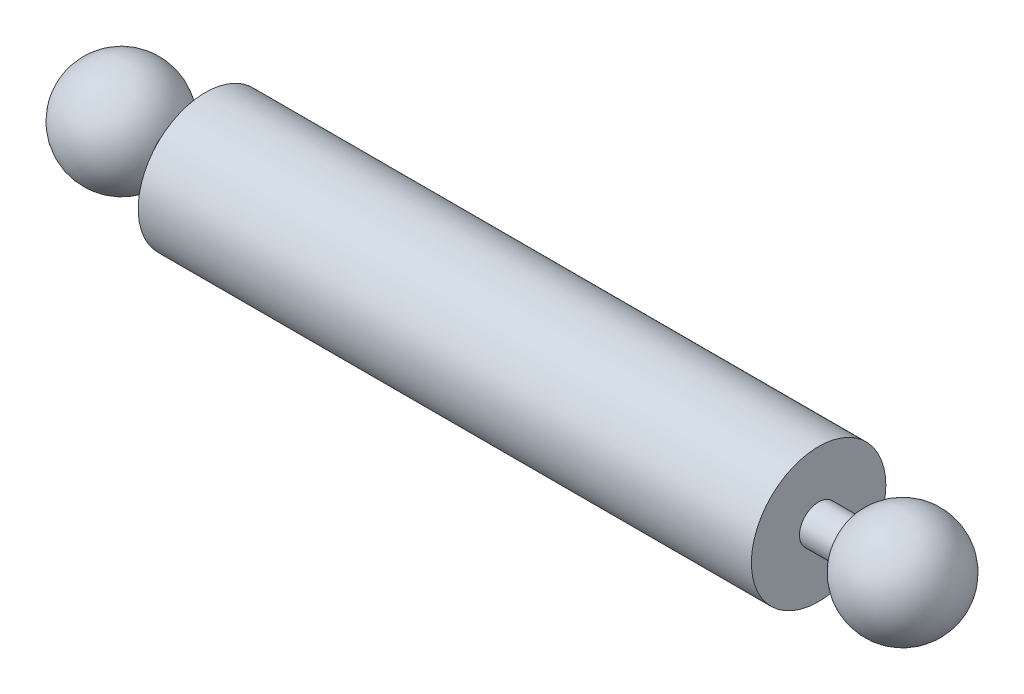
from build123d import *

# Parameters (mm, degrees)
SKETCH1_R           = 5.56895
BOSS_EXTRUDE1_DEPTH = 25.4
SKETCH2_R           = 1.5875
BOSS_EXTRUDE2_DEPTH = 3.175
SKETCH5_R           = 1.5875
CUT_EXTRUDE1_DEPTH  = 6.35
THREAD1_PITCH       = 0.529166667


with BuildPart() as part:
    # Sketch1 → Boss-Extrude1 (new, symmetric)
    with BuildSketch(Plane(origin=(0, 0, 0), x_dir=(0, 0, -1), z_dir=(1, 0, 0))):
        Circle(SKETCH1_R)
    extrude(amount=BOSS_EXTRUDE1_DEPTH, both=True)

    # Sketch2 → Boss-Extrude2 (add)
    with BuildSketch(Plane.ZY.offset(25.4)):
        Circle(SKETCH2_R)
    boss_extrude2 = extrude(amount=BOSS_EXTRUDE2_DEPTH)

    # Sketch4 → Revolve1 (revolve)
    with BuildSketch(Plane.XY):
        with BuildLine():
            Line((-36.7792, 0), (-27.94, 0))
            ThreePointArc((-27.94, 0), (-32.3596, 4.4196), (-36.7792, 0))
        make_face()
    revolve1 = revolve(axis=Axis((-36.7792, 0, 0), (1, 0, 0)))

    # Mirror1: Boss-Extrude2, Revolve1 across plane
    add(boss_extrude2.mirror(Plane(origin=(0, 0, 0), x_dir=(0, 0, 1), z_dir=(1, 0, 0))))
    add(revolve1.mirror(Plane(origin=(0, 0, 0), x_dir=(0, 0, 1), z_dir=(1, 0, 0))))

    # Sketch5 → Cut-Extrude1 (cut)
    with BuildSketch(Plane.XY):
        with Locations((12.7, 0)):
            Circle(SKETCH5_R)
    extrude(amount=-CUT_EXTRUDE1_DEPTH, mode=Mode.SUBTRACT)

    # Thread1: the profile of Thread Profile2 profile screwed along a right-hand helix of 11.099213 turns, 6 arcs to a turn; built about Z, then put on its axis
    thread1_z = Axis((0, 0, 0), (0, 0, 1))
    thread1_corners = [(1.5872, 0, -0.000173205), (1.873919859, 0, 0.165364583), (1.873919859, 0, 0.231510416), (1.5872, 0, 0.397048204)]
    with BuildLine(mode=Mode.PRIVATE) as thread1_profile:
        Line(thread1_corners[0], thread1_corners[1])
        Line(thread1_corners[1], thread1_corners[2])
        Line(thread1_corners[2], thread1_corners[3])
        Line(thread1_corners[3], thread1_corners[0])
    thread1_cap = Face(thread1_profile.wire())
    thread1_turn_angles = [0, 30, 60, 90, 120, 150, 180, 210, 240, 270, 300, 330, 360]
    thread1_turn_weights = [1, 0.8660254037844387, 1, 0.8660254037844387, 1, 0.8660254037844387, 1, 0.8660254037844387, 1, 0.8660254037844387, 1, 0.8660254037844387, 1]
    thread1_turn_rails = [Edge.make_bspline([Vector(p[0], p[1], 0).rotate(thread1_z, thread1_turn_angles[k]) / thread1_turn_weights[k] + Vector(0, 0, p[2] + THREAD1_PITCH * thread1_turn_angles[k] / 360) for k in range(13)], [0, 0, 0, 1, 1, 2, 2, 3, 3, 4, 4, 5, 5, 6, 6, 6], 2, thread1_turn_weights) for p in thread1_corners]
    thread1_turn_sides = [Face.make_surface_from_curves(thread1_turn_rails[p[0]], thread1_turn_rails[p[1]]) for p in [(0, 1), (1, 2), (2, 3), (3, 0)]]
    thread1_last_angles = [3960, 3977.858267717, 3995.716535433]
    thread1_last_weights = [1, 0.9518180194750062, 1]
    thread1_last_rails = [Edge.make_bspline([Vector(p[0], p[1], 0).rotate(thread1_z, thread1_last_angles[k]) / thread1_last_weights[k] + Vector(0, 0, p[2] + THREAD1_PITCH * thread1_last_angles[k] / 360) for k in range(3)], [0, 0, 0, 1, 1, 1], 2, thread1_last_weights) for p in thread1_corners]
    thread1_last_sides = [Face.make_surface_from_curves(thread1_last_rails[p[0]], thread1_last_rails[p[1]]) for p in [(0, 1), (1, 2), (2, 3), (3, 0)]]
    thread1 = Plane(origin=(12.7, 0, 0), x_dir=(-1, 0, 0), z_dir=(0, 0, -1)) * Solid(Shell([*[p.moved(Location((0, 0, THREAD1_PITCH * i))) for i in range(11) for p in thread1_turn_sides], *thread1_last_sides, thread1_cap, thread1_cap.rotate(thread1_z, 3995.716535433).moved(Location((0, 0, THREAD1_PITCH * 3995.716535433 / 360)))]))
    add(thread1, mode=Mode.SUBTRACT)


solid = part.part
